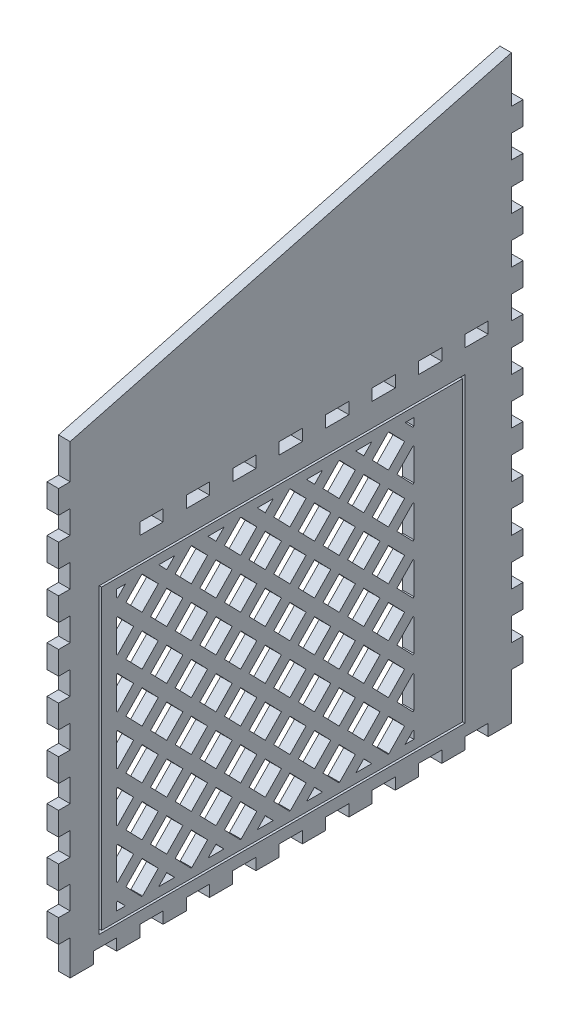
from build123d import *

# Parameters (mm, degrees)
SALIENTE_EXTRUIR1_DEPTH = 5
CROQUIS8_W              = 157.5
CROQUIS8_H              = 130
CROQUIS8_W_2            = 155.5
CROQUIS8_H_2            = 128
CORTAR_EXTRUIR2_DEPTH   = 1
CROQUIS9_W              = 10
CROQUIS9_H              = 5
CORTAR_EXTRUIR3_DEPTH   = 321.195252932
CROQUIS8_3_W            = 157.5
CROQUIS8_3_H            = 130
CROQUIS8_3_W_2          = 155.5
CROQUIS8_3_H_2          = 128
CORTAR_EXTRUIR5_DEPTH   = 5


# Read off the part's stored shape, not the designer's step: Saliente-Extruir1
with BuildPart() as part:
    # Saliente-Extruir1 outline → Saliente-Extruir1 (new body)
    with BuildSketch(Plane(origin=(0, 0, 0), x_dir=(0, 0, -1), z_dir=(1, 0, 0))):
        Polygon((200, 230), (195, 230), (195, 250), (5.000000001, 199.999999998), (5, 185), (0, 185), (0, 175), (5, 175), (5, 165), (0, 165), (0, 155), (5, 155), (5, 145), (0, 145), (0, 135), (5, 135), (5, 125), (0, 125), (0, 115), (5, 115), (5, 105), (0, 105), (0, 95), (5, 95), (5, 85), (0, 85), (0, 75), (5, 75), (5, 65), (0, 65), (0, 55), (5, 55), (5, 45), (0, 45), (0, 35), (5, 35), (5, 25), (0, 25), (0, 15), (5, 15), (5, 0), (15, 0), (15, 5), (25, 5), (25, 0), (35, 0), (35, 5), (45, 5), (45, 0), (55, 0), (55, 5), (65, 5), (65, 0), (75, 0), (75, 5), (85, 5), (85, 0), (95, 0), (95, 5), (105, 5), (105, 0), (115, 0), (115, 5), (125, 5), (125, 0), (135, 0), (135, 5), (145, 5), (145, 0), (155, 0), (155, 5), (165, 5), (165, 0), (175, 0), (175, 5), (185, 5), (185, 0), (195, 0), (195, 20), (200, 20), (200, 30), (195, 30), (195, 40), (200, 40), (200, 50), (195, 50), (195, 60), (200, 60), (200, 70), (195, 70), (195, 80), (200, 80), (200, 90), (195, 90), (195, 100), (200, 100), (200, 110), (195, 110), (195, 120), (200, 120), (200, 130), (195, 130), (195, 140), (200, 140), (200, 150), (195, 150), (195, 160), (200, 160), (200, 170), (195, 170), (195, 180), (200, 180), (200, 190), (195, 190), (195, 200), (200, 200), (200, 210), (195, 210), (195, 220), (200, 220), align=None)
        Polygon((24.999999999, 18.166295489), (25.360389744, 18.537774508), (28.792555726, 15), (24.999999999, 15), align=None, mode=Mode.SUBTRACT)
        Polygon((29.003863658, 21.966991401), (35.9669914, 29.144376165), (42.930119143, 21.966991401), (36.171104167, 15), (35.762878634, 15), align=None, mode=Mode.SUBTRACT)
        Polygon((43.141427202, 15), (46.57359312, 18.537774443), (50.005759039, 15), align=None, mode=Mode.SUBTRACT)
        Polygon((32.323517581, 32.573593163), (25.360389839, 25.3962084), (24.999999999, 25.767687517), (24.999999999, 39.37949881), (25.360389839, 39.750977927), align=None, mode=Mode.SUBTRACT)
        Polygon((29.003863806, 43.180194872), (35.966991548, 50.357579636), (42.930119291, 43.180194872), (35.966991548, 36.002810109), align=None, mode=Mode.SUBTRACT)
        Polygon((39.61046542, 32.573593163), (46.573593163, 39.750977927), (53.536720905, 32.573593163), (46.573593163, 25.3962084), align=None, mode=Mode.SUBTRACT)
        Polygon((32.323517676, 53.786796582), (25.360389934, 46.609411818), (24.999999999, 46.980891033), (24.999999999, 60.592702131), (25.360389934, 60.964181345), align=None, mode=Mode.SUBTRACT)
        Polygon((53.536721, 53.786796582), (46.573593257, 46.609411818), (39.610465515, 53.786796582), (46.573593257, 60.964181345), align=None, mode=Mode.SUBTRACT)
        Polygon((50.217067098, 21.966991399), (57.18019484, 29.144376163), (64.143322582, 21.966991399), (57.384307608, 15), (56.976082072, 15), align=None, mode=Mode.SUBTRACT)
        Polygon((71.218962476, 15), (64.354630643, 15), (67.78679656, 18.537774441), align=None, mode=Mode.SUBTRACT)
        Polygon((71.430270537, 21.966991397), (78.39339828, 29.14437616), (85.356526022, 21.966991397), (78.59751105, 15), (78.189285509, 15), align=None, mode=Mode.SUBTRACT)
        Polygon((88.999999999, 18.537774438), (92.432165914, 15), (85.567834085, 15), align=None, mode=Mode.SUBTRACT)
        Polygon((106.569729461, 21.966991397), (99.810714489, 15), (99.402488949, 15), (92.643473977, 21.966991397), (99.606601719, 29.14437616), align=None, mode=Mode.SUBTRACT)
        Polygon((50.217067129, 43.180194872), (57.180194872, 50.357579636), (64.143322614, 43.180194872), (57.180194872, 36.002810109), align=None, mode=Mode.SUBTRACT)
        Polygon((60.823668817, 32.573593119), (67.78679656, 39.750977882), (74.749924302, 32.573593119), (67.78679656, 25.396208355), align=None, mode=Mode.SUBTRACT)
        Polygon((60.823668838, 53.786796582), (67.786796581, 60.964181345), (74.749924323, 53.786796582), (67.786796581, 46.609411818), align=None, mode=Mode.SUBTRACT)
        Polygon((71.430270537, 43.180194839), (78.39339828, 50.357579602), (85.356526022, 43.180194839), (78.39339828, 36.002810075), align=None, mode=Mode.SUBTRACT)
        Polygon((88.999999999, 25.396208353), (82.036872257, 32.573593117), (88.999999999, 39.75097788), (95.963127742, 32.573593117), align=None, mode=Mode.SUBTRACT)
        Polygon((106.569729461, 43.180194839), (99.606601719, 36.002810075), (92.643473977, 43.180194839), (99.606601719, 50.357579602), align=None, mode=Mode.SUBTRACT)
        Polygon((88.999999999, 46.609411795), (82.036872257, 53.786796558), (88.999999999, 60.964181322), (95.963127742, 53.786796558), align=None, mode=Mode.SUBTRACT)
        Polygon((29.0038639, 64.393398291), (35.966991643, 71.570783054), (42.930119385, 64.393398291), (35.966991643, 57.216013527), align=None, mode=Mode.SUBTRACT)
        Polygon((24.999999999, 81.805905451), (25.360390028, 82.177384763), (32.323517771, 75), (25.360390028, 67.822615237), (24.999999999, 68.194094549), align=None, mode=Mode.SUBTRACT)
        Polygon((53.536721094, 75), (46.573593352, 67.822615237), (39.61046561, 75), (46.573593352, 82.177384763), align=None, mode=Mode.SUBTRACT)
        Polygon((29.0038639, 85.606601709), (35.966991643, 92.783986473), (42.930119385, 85.606601709), (35.966991643, 78.429216946), align=None, mode=Mode.SUBTRACT)
        Polygon((25.360389934, 89.035818655), (24.999999999, 89.407297869), (24.999999999, 103.019108967), (25.360389934, 103.390588182), (32.323517676, 96.213203418), align=None, mode=Mode.SUBTRACT)
        Polygon((29.003863806, 106.819805128), (35.966991548, 113.997189891), (42.930119291, 106.819805128), (35.966991548, 99.642420364), align=None, mode=Mode.SUBTRACT)
        Polygon((39.610465515, 96.213203418), (46.573593257, 103.390588182), (53.536721, 96.213203418), (46.573593257, 89.035818655), align=None, mode=Mode.SUBTRACT)
        Polygon((25.360389839, 110.249022073), (24.999999999, 110.62050119), (24.999999999, 124.232312483), (25.360389839, 124.6037916), (32.323517581, 117.426406837), align=None, mode=Mode.SUBTRACT)
        Polygon((39.61046542, 117.426406837), (46.573593163, 124.6037916), (53.536720905, 117.426406837), (46.573593163, 110.249022073), align=None, mode=Mode.SUBTRACT)
        Polygon((50.217067224, 64.393398291), (57.180194966, 71.570783054), (64.143322709, 64.393398291), (57.180194966, 57.216013527), align=None, mode=Mode.SUBTRACT)
        Polygon((74.749924418, 75), (67.786796676, 67.822615237), (60.823668933, 75), (67.786796676, 82.177384763), align=None, mode=Mode.SUBTRACT)
        Polygon((50.217067224, 85.606601709), (57.180194966, 92.783986473), (64.143322709, 85.606601709), (57.180194966, 78.429216946), align=None, mode=Mode.SUBTRACT)
        Polygon((71.430270548, 64.393398291), (78.39339829, 71.570783054), (85.356526033, 64.393398291), (78.39339829, 57.216013527), align=None, mode=Mode.SUBTRACT)
        Polygon((106.569729451, 64.393398291), (99.606601708, 57.216013527), (92.643473966, 64.393398291), (99.606601708, 71.570783054), align=None, mode=Mode.SUBTRACT)
        Polygon((95.963127742, 75), (88.999999999, 67.822615237), (82.036872257, 75), (88.999999999, 82.177384763), align=None, mode=Mode.SUBTRACT)
        Polygon((71.430270548, 85.606601709), (78.39339829, 92.783986473), (85.356526033, 85.606601709), (78.39339829, 78.429216946), align=None, mode=Mode.SUBTRACT)
        Polygon((106.569729451, 85.606601709), (99.606601708, 78.429216946), (92.643473966, 85.606601709), (99.606601708, 92.783986473), align=None, mode=Mode.SUBTRACT)
        Polygon((50.217067129, 106.819805128), (57.180194872, 113.997189891), (64.143322614, 106.819805128), (57.180194872, 99.642420364), align=None, mode=Mode.SUBTRACT)
        Polygon((60.823668838, 96.213203418), (67.786796581, 103.390588182), (74.749924323, 96.213203418), (67.786796581, 89.035818655), align=None, mode=Mode.SUBTRACT)
        Polygon((60.823668817, 117.426406881), (67.78679656, 124.603791645), (74.749924302, 117.426406881), (67.78679656, 110.249022118), align=None, mode=Mode.SUBTRACT)
        Polygon((71.430270537, 106.819805161), (78.39339828, 113.997189925), (85.356526022, 106.819805161), (78.39339828, 99.642420398), align=None, mode=Mode.SUBTRACT)
        Polygon((88.999999999, 89.035818678), (82.036872257, 96.213203442), (88.999999999, 103.390588205), (95.963127742, 96.213203442), align=None, mode=Mode.SUBTRACT)
        Polygon((106.569729461, 106.819805161), (99.606601719, 99.642420398), (92.643473977, 106.819805161), (99.606601719, 113.997189925), align=None, mode=Mode.SUBTRACT)
        Polygon((88.999999999, 110.24902212), (82.036872257, 117.426406883), (88.999999999, 124.603791647), (95.963127742, 117.426406883), align=None, mode=Mode.SUBTRACT)
        Polygon((110.213203439, 18.537774441), (113.645369355, 15), (106.781037522, 15), align=None, mode=Mode.SUBTRACT)
        Polygon((127.782932901, 21.966991399), (121.023917927, 15), (120.61569239, 15), (113.856677416, 21.966991399), (120.819805158, 29.144376163), align=None, mode=Mode.SUBTRACT)
        Polygon((131.426406878, 18.537774443), (134.858572797, 15), (127.99424096, 15), align=None, mode=Mode.SUBTRACT)
        Polygon((148.99613634, 21.966991401), (142.237121364, 15), (141.828895832, 15), (135.069880856, 21.966991401), (142.033008598, 29.144376165), align=None, mode=Mode.SUBTRACT)
        Polygon((117.176331181, 32.573593119), (110.213203439, 25.396208355), (103.250075696, 32.573593119), (110.213203439, 39.750977882), align=None, mode=Mode.SUBTRACT)
        Polygon((127.782932869, 43.180194872), (120.819805127, 36.002810109), (113.856677384, 43.180194872), (120.819805127, 50.357579636), align=None, mode=Mode.SUBTRACT)
        Polygon((117.17633116, 53.786796582), (110.213203418, 46.609411818), (103.250075675, 53.786796582), (110.213203418, 60.964181345), align=None, mode=Mode.SUBTRACT)
        Polygon((138.389534578, 32.573593163), (131.426406836, 25.3962084), (124.463279094, 32.573593163), (131.426406836, 39.750977927), align=None, mode=Mode.SUBTRACT)
        Polygon((152.63961016, 39.750977927), (152.999999999, 39.37949881), (152.999999999, 25.767687517), (152.63961016, 25.3962084), (145.676482417, 32.573593163), align=None, mode=Mode.SUBTRACT)
        Polygon((148.996136193, 43.180194872), (142.03300845, 36.002810109), (135.069880708, 43.180194872), (142.03300845, 50.357579636), align=None, mode=Mode.SUBTRACT)
        Polygon((138.389534484, 53.786796582), (131.426406741, 46.609411818), (124.463278999, 53.786796582), (131.426406741, 60.964181345), align=None, mode=Mode.SUBTRACT)
        Polygon((152.639610065, 60.964181345), (152.999999999, 60.592702131), (152.999999999, 46.980891033), (152.639610065, 46.609411818), (145.676482322, 53.786796582), align=None, mode=Mode.SUBTRACT)
        Polygon((152.639610254, 18.537774508), (152.999999999, 18.166295489), (152.999999999, 15), (149.207444272, 15), align=None, mode=Mode.SUBTRACT)
        Polygon((117.176331065, 75), (110.213203323, 67.822615237), (103.25007558, 75), (110.213203323, 82.177384763), align=None, mode=Mode.SUBTRACT)
        Polygon((127.782932774, 64.393398291), (120.819805032, 57.216013527), (113.85667729, 64.393398291), (120.819805032, 71.570783054), align=None, mode=Mode.SUBTRACT)
        Polygon((127.782932774, 85.606601709), (120.819805032, 78.429216946), (113.85667729, 85.606601709), (120.819805032, 92.783986473), align=None, mode=Mode.SUBTRACT)
        Polygon((138.389534389, 75), (131.426406646, 67.822615237), (124.463278904, 75), (131.426406646, 82.177384763), align=None, mode=Mode.SUBTRACT)
        Polygon((148.996136098, 64.393398291), (142.033008356, 57.216013527), (135.069880613, 64.393398291), (142.033008356, 71.570783054), align=None, mode=Mode.SUBTRACT)
        Polygon((152.999999999, 68.194094549), (152.63960997, 67.822615237), (145.676482228, 75), (152.63960997, 82.177384763), (152.999999999, 81.805905451), align=None, mode=Mode.SUBTRACT)
        Polygon((148.996136098, 85.606601709), (142.033008356, 78.429216946), (135.069880613, 85.606601709), (142.033008356, 92.783986473), align=None, mode=Mode.SUBTRACT)
        Polygon((117.17633116, 96.213203418), (110.213203418, 89.035818655), (103.250075675, 96.213203418), (110.213203418, 103.390588182), align=None, mode=Mode.SUBTRACT)
        Polygon((127.782932869, 106.819805128), (120.819805127, 99.642420364), (113.856677384, 106.819805128), (120.819805127, 113.997189891), align=None, mode=Mode.SUBTRACT)
        Polygon((117.176331181, 117.426406881), (110.213203439, 110.249022118), (103.250075696, 117.426406881), (110.213203439, 124.603791645), align=None, mode=Mode.SUBTRACT)
        Polygon((138.389534484, 96.213203418), (131.426406741, 89.035818655), (124.463278999, 96.213203418), (131.426406741, 103.390588182), align=None, mode=Mode.SUBTRACT)
        Polygon((145.676482322, 96.213203418), (152.639610065, 103.390588182), (152.999999999, 103.019108967), (152.999999999, 89.407297869), (152.639610065, 89.035818655), align=None, mode=Mode.SUBTRACT)
        Polygon((148.996136193, 106.819805128), (142.03300845, 99.642420364), (135.069880708, 106.819805128), (142.03300845, 113.997189891), align=None, mode=Mode.SUBTRACT)
        Polygon((138.389534578, 117.426406837), (131.426406836, 110.249022073), (124.463279094, 117.426406837), (131.426406836, 124.6037916), align=None, mode=Mode.SUBTRACT)
        Polygon((145.676482417, 117.426406837), (152.63961016, 124.6037916), (152.999999999, 124.232312483), (152.999999999, 110.62050119), (152.63961016, 110.249022073), align=None, mode=Mode.SUBTRACT)
        Polygon((29.003863658, 128.033008599), (35.762878634, 135), (36.171104167, 135), (42.930119143, 128.033008599), (35.9669914, 120.855623835), align=None, mode=Mode.SUBTRACT)
        Polygon((25.360389744, 131.462225492), (24.999999999, 131.833704511), (24.999999999, 135), (28.792555726, 135), align=None, mode=Mode.SUBTRACT)
        Polygon((46.57359312, 131.462225557), (43.141427202, 135), (50.005759039, 135), align=None, mode=Mode.SUBTRACT)
        Polygon((50.217067098, 128.033008601), (56.976082072, 135), (57.384307608, 135), (64.143322582, 128.033008601), (57.18019484, 120.855623837), align=None, mode=Mode.SUBTRACT)
        Polygon((67.78679656, 131.462225559), (64.354630643, 135), (71.218962476, 135), align=None, mode=Mode.SUBTRACT)
        Polygon((71.430270537, 128.033008603), (78.189285509, 135), (78.59751105, 135), (85.356526022, 128.033008603), (78.39339828, 120.85562384), align=None, mode=Mode.SUBTRACT)
        Polygon((92.643473977, 128.033008603), (99.402488949, 135), (99.810714489, 135), (106.569729461, 128.033008603), (99.606601719, 120.85562384), align=None, mode=Mode.SUBTRACT)
        Polygon((85.567834085, 135), (92.432165914, 135), (88.999999999, 131.462225562), align=None, mode=Mode.SUBTRACT)
        Polygon((113.645369355, 135), (110.213203439, 131.462225559), (106.781037522, 135), align=None, mode=Mode.SUBTRACT)
        Polygon((113.856677416, 128.033008601), (120.61569239, 135), (121.023917927, 135), (127.782932901, 128.033008601), (120.819805158, 120.855623837), align=None, mode=Mode.SUBTRACT)
        Polygon((134.858572797, 135), (131.426406878, 131.462225557), (127.99424096, 135), align=None, mode=Mode.SUBTRACT)
        Polygon((135.069880856, 128.033008599), (141.828895832, 135), (142.237121364, 135), (148.99613634, 128.033008599), (142.033008598, 120.855623835), align=None, mode=Mode.SUBTRACT)
        Polygon((149.207444272, 135), (152.999999999, 135), (152.999999999, 131.833704511), (152.639610254, 131.462225492), align=None, mode=Mode.SUBTRACT)
    extrude(amount=SALIENTE_EXTRUIR1_DEPTH)

    # Croquis8 → Cortar-Extruir2 (cut)
    with BuildSketch(Plane(origin=(5, 0, 0), x_dir=(0, 0, -1), z_dir=(1, 0, 0))):
        with Locations((96.249999999, 75)):
            Rectangle(CROQUIS8_W, CROQUIS8_H)
        with Locations((96.249999999, 75)):
            Rectangle(CROQUIS8_W_2, CROQUIS8_H_2, mode=Mode.SUBTRACT)
    extrude(amount=-CORTAR_EXTRUIR2_DEPTH, mode=Mode.SUBTRACT)

    # Croquis9 → Cortar-Extruir3 (cut, through all)
    with BuildSketch(Plane(origin=(5, 0, 0), x_dir=(0, 0, -1), z_dir=(1, 0, 0))):
        with Locations((40.012433994, 152.5)):
            Rectangle(CROQUIS9_W, CROQUIS9_H)
        with Locations((60.012433994, 152.5)):
            Rectangle(CROQUIS9_W, CROQUIS9_H)
        with Locations((80.012433994, 152.5)):
            Rectangle(CROQUIS9_W, CROQUIS9_H)
        with Locations((100.012433994, 152.5)):
            Rectangle(CROQUIS9_W, CROQUIS9_H)
        with Locations((120.012433994, 152.5)):
            Rectangle(CROQUIS9_W, CROQUIS9_H)
        with Locations((140.012433994, 152.5)):
            Rectangle(CROQUIS9_W, CROQUIS9_H)
        with Locations((160.012433994, 152.5)):
            Rectangle(CROQUIS9_W, CROQUIS9_H)
        with Locations((180, 152.5)):
            Rectangle(CROQUIS9_W, CROQUIS9_H)
    extrude(amount=-CORTAR_EXTRUIR3_DEPTH, mode=Mode.SUBTRACT)

    # Croquis8<3> → Cortar-Extruir5 (cut)
    with BuildSketch(Plane(origin=(5, 0, 0), x_dir=(0, 0, -1), z_dir=(1, 0, 0))):
        with Locations((96.249999999, 75)):
            Rectangle(CROQUIS8_3_W, CROQUIS8_3_H)
        with Locations((96.249999999, 75)):
            Rectangle(CROQUIS8_3_W_2, CROQUIS8_3_H_2, mode=Mode.SUBTRACT)
    extrude(amount=-CORTAR_EXTRUIR5_DEPTH, mode=Mode.SUBTRACT)


with BuildPart() as cortar_extruir5_piece_1:
    # of the separate pieces the step leaves, piece 1, a body of its own (cortar_extruir5_pieces)
    add(part.part.solids().sort_by_distance((0, 230, -200))[0])


with BuildPart() as cortar_extruir5_piece_2:
    # of the separate pieces the step leaves, piece 2, a body of its own (cortar_extruir5_pieces)
    add(part.part.solids().sort_by_distance((0, 11, -18.499999999))[0])


solid = Compound([cortar_extruir5_piece_1.part, cortar_extruir5_piece_2.part])
